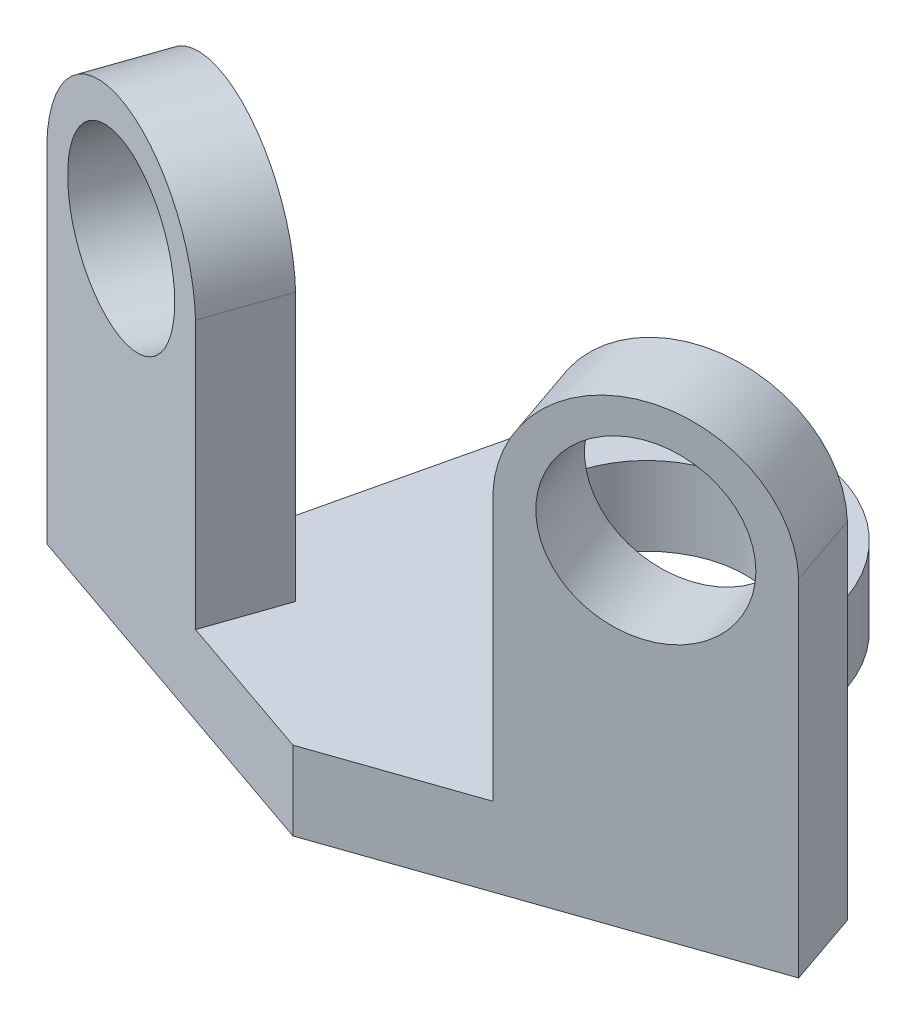
from build123d import *

# Parameters (mm, degrees)
BOSS_EXTRUDE1_DEPTH = 10
BOSS_EXTRUDE3_DEPTH = 50
CUT_EXTRUDE2_START  = -10
CUT_EXTRUDE2_DEPTH  = 10
CUT_EXTRUDE3_START  = -10
CUT_EXTRUDE3_DEPTH  = 10
SKETCH9_R           = 11
CUT_EXTRUDE4_DEPTH  = 10
SKETCH10_R          = 11
CUT_EXTRUDE5_DEPTH  = 10


# Read off the part's stored shape, not the designer's step: Cut-Extrude2, Cut-Extrude3
with BuildPart() as part:
    # Sketch2 → Boss-Extrude1 (new body)
    with BuildSketch(Plane(origin=(0, 0, 0), x_dir=(1, 0, 0), z_dir=(0, 1, 0))):
        with BuildLine():
            ThreePointArc((0, 20), (-12.427112426, 15.670573594), (-19.473997983, 4.556687675))
            Line((-19.473997983, 4.556687675), (-26.455560952, -25.280543414))
            Line((-26.455560952, -25.280543414), (-15.63841821, -29.017513463))
            Line((-15.63841821, -29.017513463), (-18.903729183, -38.469378055))
            Line((-18.903729183, -38.469378055), (0, -45))
            Line((0, -45), (0, -12.5))
            ThreePointArc((0, -12.5), (-12.5, 0), (0, 12.5))
            Line((0, 12.5), (0, 20))
        make_face()
        with BuildLine():
            ThreePointArc((19.473997983, 4.556687675), (12.427112426, 15.670573594), (0, 20))
            Line((0, 20), (0, 12.5))
            ThreePointArc((0, 12.5), (8.838834765, 8.838834765), (12.5, 0))
            ThreePointArc((12.5, 0), (8.838834765, -8.838834765), (0, -12.5))
            Line((0, -12.5), (0, -45))
            Line((0, -45), (18.903729183, -38.469378055))
            Line((18.903729183, -38.469378055), (15.63841821, -29.017513463))
            Line((15.63841821, -29.017513463), (26.455560952, -25.280543414))
            Line((26.455560952, -25.280543414), (19.473997983, 4.556687675))
        make_face()
        Polygon((44.52777222, -19.037183791), (26.455560952, -25.280543414), (15.63841821, -29.017513463), (18.903729183, -38.469378055), (47.793083193, -28.489048382), align=None)
        Polygon((-15.63841821, -29.017513463), (-26.455560952, -25.280543414), (-44.52777222, -19.037183791), (-47.793083193, -28.489048382), (-18.903729183, -38.469378055), align=None)
    extrude(amount=BOSS_EXTRUDE1_DEPTH)

    # Sketch6 → Boss-Extrude3 (add)
    with BuildSketch(Plane(origin=(0, 10, 0), x_dir=(1, 0, 0), z_dir=(0, 1, 0))):
        Polygon((47.793083193, -28.489048382), (44.52777222, -19.037183791), (15.63841821, -29.017513463), (18.903729183, -38.469378055), align=None)
        Polygon((-47.793083193, -28.489048382), (-44.52777222, -19.037183791), (-15.63841821, -29.017513463), (-18.903729183, -38.469378055), align=None)
    extrude(amount=BOSS_EXTRUDE3_DEPTH)

    # Cut-Extrude2 outline → Cut-Extrude2 (cut)
    with BuildSketch(Plane(origin=(-13.888474723, 0, 40.201984913), x_dir=(0.9451864591285483, 0, 0.32653109726339585), z_dir=(-0.3265310972633958, 0, 0.9451864591285482)).offset(CUT_EXTRUDE2_START)):
        with BuildLine():
            ThreePointArc((-35.870814845, 44.066794658), (-20.588457734, 58.63224641), (-5.306100623, 44.066794658))
            Line((-5.306100623, 44.066794658), (-5.306100623, 60))
            Line((-5.306100623, 60), (-35.870814845, 60))
            Line((-35.870814845, 60), (-35.870814845, 44.066794658))
        make_face()
    extrude(amount=CUT_EXTRUDE2_DEPTH, mode=Mode.SUBTRACT)

    # Cut-Extrude3 outline → Cut-Extrude3 (cut)
    with BuildSketch(Plane(origin=(13.888474723, 0, 40.201984913), x_dir=(0.9451864591285483, 0, -0.3265310972633959), z_dir=(0.3265310972633959, 0, 0.9451864591285483)).offset(CUT_EXTRUDE3_START)):
        with BuildLine():
            ThreePointArc((5.306100623, 43.936741919), (20.588457734, 58.743356846), (35.870814845, 43.936741919))
            Line((35.870814845, 43.936741919), (35.870814845, 60))
            Line((35.870814845, 60), (5.306100623, 60))
            Line((5.306100623, 60), (5.306100623, 43.936741919))
        make_face()
    extrude(amount=CUT_EXTRUDE3_DEPTH, mode=Mode.SUBTRACT)

    # Sketch9 → Cut-Extrude4 (cut)
    with BuildSketch(Plane(origin=(-13.888474723, 0, 40.201984913), x_dir=(0.9451864591285483, 0, 0.32653109726339585), z_dir=(-0.3265310972633958, 0, 0.9451864591285482))):
        with Locations((-20.588457734, 43.33224641)):
            Circle(SKETCH9_R)
    extrude(amount=-CUT_EXTRUDE4_DEPTH, mode=Mode.SUBTRACT)

    # Sketch10 → Cut-Extrude5 (cut)
    with BuildSketch(Plane(origin=(13.888474723, 0, 40.201984913), x_dir=(0.9451864591285483, 0, -0.3265310972633959), z_dir=(0.3265310972633959, 0, 0.9451864591285483))):
        with Locations((20.588457734, 43.453356846)):
            Circle(SKETCH10_R)
    extrude(amount=-CUT_EXTRUDE5_DEPTH, mode=Mode.SUBTRACT)


solid = part.part
